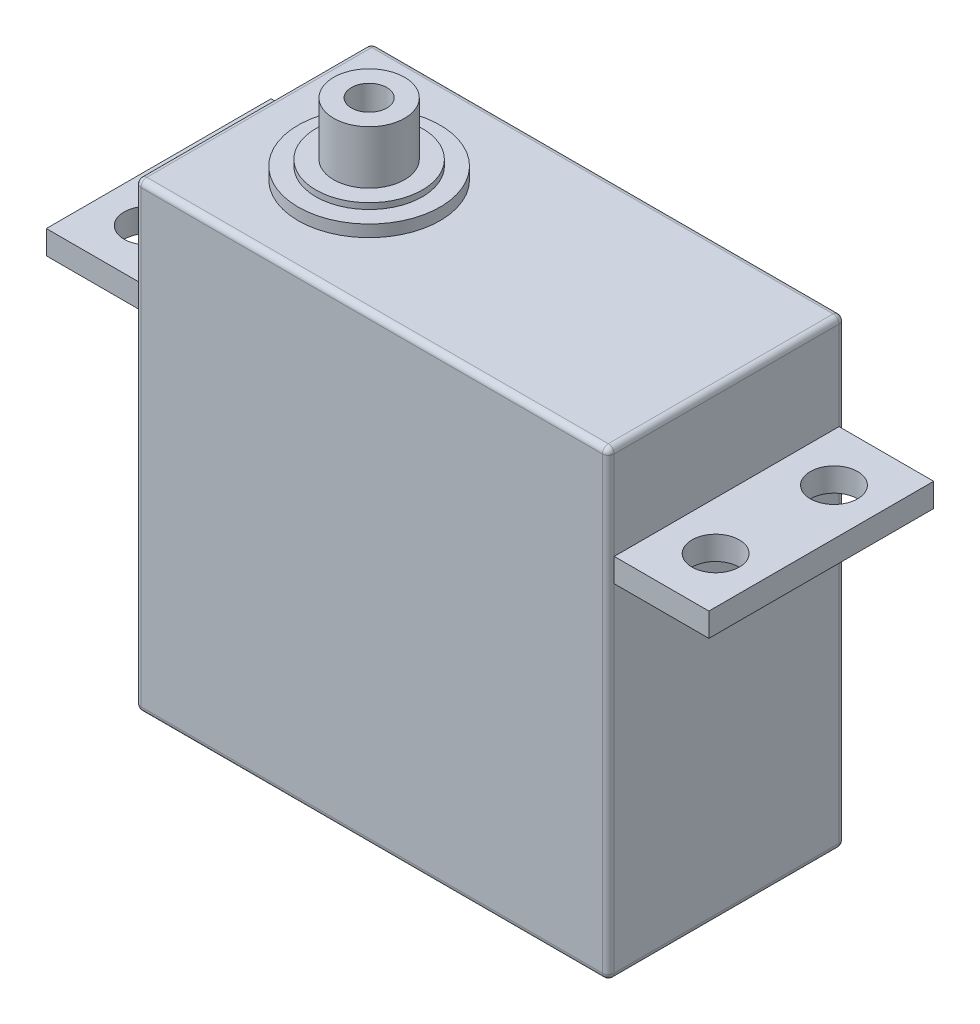
from build123d import *

# Parameters (mm, degrees)
SKETCH_1_W          = 40
SKETCH_1_H          = 39
EXTRUDE_2_DEPTH     = 20
FILLET_2_R          = 0.5
FILLET_3_R          = 0.5
FILLET_4_R          = 0.5
FILLET_5_R          = 0.5
SKETCH_6_W          = 19
SKETCH_6_H          = 2
EXTRUDE_3_DEPTH     = 8
SKETCH_7_W          = 19
SKETCH_7_H          = 2
EXTRUDE_5_DEPTH     = 8
SKETCH_8_R          = 2
CUT_EXTRUDE_1_DEPTH = 28
SKETCH_9_R          = 6
SKETCH_9_R_2        = 4.5
EXTRUDE_7_DEPTH     = 1
SKETCH_10_R         = 4.5
EXTRUDE_8_DEPTH     = 1.5
SKETCH_11_R         = 3
EXTRUDE_9_DEPTH     = 4.5
SKETCH_12_R         = 1.5
CUT_EXTRUDE_2_DEPTH = 6


with BuildPart() as part:
    # 草图1 → 凸台-拉伸2 (new body)
    with BuildSketch(Plane.XY):
        with Locations((20, 19.5)):
            Rectangle(SKETCH_1_W, SKETCH_1_H)
    extrude(amount=EXTRUDE_2_DEPTH)

    # 圆角2
    fillet_2_edges = [part.edges().sort_by_distance(p)[0] for p in [
        (40, 19.5, 20),
        (20, 39, 20),
    ]]
    fillet(fillet_2_edges, radius=FILLET_2_R)

    # 圆角3
    fillet_3_edges = [part.edges().sort_by_distance(p)[0] for p in [
        (40, 0, 9.75),
        (19.75, 0, 20),
        (39.853553391, 0, 19.853553391),
        (0, 39, 9.75),
        (0, 38.853553391, 19.853553391),
        (0, 19.25, 20),
    ]]
    fillet(fillet_3_edges, radius=FILLET_3_R)

    # 圆角4
    # the kernel refuses this fillet: 0.5 mm, written as the material it takes off along each edge
    with BuildSketch(Plane(origin=(39.5, 38.5, 19.5), x_dir=(0, 1, 0), z_dir=(1, 0, 0))) as fillet_4_piece_1_section:
        Polygon((0, 0), (FILLET_4_R, 0), (FILLET_4_R, FILLET_4_R), (0, FILLET_4_R), align=None)
    fillet_4_piece_1 = extrude(amount=FILLET_4_R, mode=Mode.PRIVATE)
    fillet_4_piece_1 = fillet_4_piece_1 - Plane(origin=(39.5, 38.5, 19.5), x_dir=(0, -0.7071067811865475, -0.7071067811865475), z_dir=(1, 0, 0)) * Sphere(FILLET_4_R, mode=Mode.PRIVATE)
    add(fillet_4_piece_1, mode=Mode.SUBTRACT)
    with BuildSketch(Plane(origin=(40, 39, -1.25), x_dir=(0, -1, 0), z_dir=(0, 0, 1))) as fillet_4_piece_2:
        with BuildLine():
            CenterArc((FILLET_4_R, -FILLET_4_R), FILLET_4_R, 90, 90)
            Line((0, -FILLET_4_R), (0, 0))
            Line((0, 0), (FILLET_4_R, 0))
        make_face()
    extrude(amount=20.75, mode=Mode.SUBTRACT)
    with BuildSketch(Plane(origin=(40, 0.5, 0), x_dir=(-1, 0, 0), z_dir=(0, 1, 0))) as fillet_4_piece_3:
        with BuildLine():
            CenterArc((FILLET_4_R, FILLET_4_R), FILLET_4_R, 180, 90)
            Line((0, FILLET_4_R), (0, 0))
            Line((0, 0), (FILLET_4_R, 0))
        make_face()
    extrude(amount=39.75, mode=Mode.SUBTRACT)
    with BuildSketch(Plane(origin=(39.5, 0.5, 0), x_dir=(0, -1, 0), z_dir=(-1, 0, 0))) as fillet_4_piece_4:
        with BuildLine():
            CenterArc((0.5 - FILLET_4_R, FILLET_4_R), FILLET_4_R, 270, 90)
            Line((0.5, FILLET_4_R), (0.5, 0))
            Line((0.5, 0), (0.5 - FILLET_4_R, 0))
        make_face()
    revolve(axis=Axis((39.5, 0.5, 0), (0, 0, 1)), revolution_arc=90, mode=Mode.SUBTRACT)
    with BuildSketch(Plane(origin=(-1.25, 0, 0), x_dir=(0, 0, 1), z_dir=(1, 0, 0))) as fillet_4_piece_5:
        with BuildLine():
            CenterArc((FILLET_4_R, -FILLET_4_R), FILLET_4_R, 90, 90)
            Line((0, -FILLET_4_R), (0, 0))
            Line((0, 0), (FILLET_4_R, 0))
        make_face()
    extrude(amount=40.75, mode=Mode.SUBTRACT)

    # 圆角5
    # the kernel refuses this fillet: 0.5 mm, written as the material it takes off along each edge
    with BuildSketch(Plane(origin=(0.5, 0.5, 19.5), x_dir=(-1, 0, 0), z_dir=(0, -1, 0))) as fillet_5_piece_1_section:
        Polygon((0, 0), (FILLET_5_R, 0), (FILLET_5_R, -FILLET_5_R), (0, -FILLET_5_R), align=None)
    fillet_5_piece_1 = extrude(amount=FILLET_5_R, mode=Mode.PRIVATE)
    fillet_5_piece_1 = fillet_5_piece_1 - Plane(origin=(0.5, 0.5, 19.5), x_dir=(0.7071067811865475, 0, -0.7071067811865475), z_dir=(0, -1, 0)) * Sphere(FILLET_5_R, mode=Mode.PRIVATE)
    add(fillet_5_piece_1, mode=Mode.SUBTRACT)
    with BuildSketch(Plane(origin=(39.5, 38.5, 0.5), x_dir=(0, 1, 0), z_dir=(0, 0, -1))) as fillet_5_piece_2_section:
        Polygon((0, 0), (FILLET_5_R, 0), (FILLET_5_R, FILLET_5_R), (0, FILLET_5_R), align=None)
    fillet_5_piece_2 = extrude(amount=FILLET_5_R, mode=Mode.PRIVATE)
    fillet_5_piece_2 = fillet_5_piece_2 - Plane(origin=(39.5, 38.5, 0.5), x_dir=(-0.7071067811865475, -0.7071067811865477, 0), z_dir=(0, 0, -1)) * Sphere(FILLET_5_R, mode=Mode.PRIVATE)
    add(fillet_5_piece_2, mode=Mode.SUBTRACT)
    with BuildSketch(Plane(origin=(39.5, 39, 0), x_dir=(0, -1, 0), z_dir=(-1, 0, 0))) as fillet_5_piece_3:
        with BuildLine():
            CenterArc((FILLET_5_R, FILLET_5_R), FILLET_5_R, 180, 90)
            Line((0, FILLET_5_R), (0, 0))
            Line((0, 0), (FILLET_5_R, 0))
        make_face()
    extrude(amount=39, mode=Mode.SUBTRACT)
    with BuildSketch(Plane(origin=(0.5, 38.5, 0), x_dir=(-1, 0, 0), z_dir=(0, -1, 0))) as fillet_5_piece_4:
        with BuildLine():
            CenterArc((0.5 - FILLET_5_R, -FILLET_5_R), FILLET_5_R, 0, 90)
            Line((0.5, -FILLET_5_R), (0.5, 0))
            Line((0.5, 0), (0.5 - FILLET_5_R, 0))
        make_face()
    revolve(axis=Axis((0.5, 38.5, 0), (0, 0, -1)), revolution_arc=90, mode=Mode.SUBTRACT)
    with BuildSketch(Plane(origin=(0, 0, 0.5), x_dir=(1, 0, 0), z_dir=(0, 0, 1))) as fillet_5_piece_5:
        with BuildLine():
            CenterArc((FILLET_5_R, FILLET_5_R), FILLET_5_R, 180, 90)
            Line((0, FILLET_5_R), (0, 0))
            Line((0, 0), (FILLET_5_R, 0))
        make_face()
    extrude(amount=19, mode=Mode.SUBTRACT)
    with BuildSketch(Plane(origin=(0, 38.5, 0), x_dir=(0, 0, 1), z_dir=(0, -1, 0))) as fillet_5_piece_6:
        with BuildLine():
            CenterArc((FILLET_5_R, -FILLET_5_R), FILLET_5_R, 90, 90)
            Line((0, -FILLET_5_R), (0, 0))
            Line((0, 0), (FILLET_5_R, 0))
        make_face()
    extrude(amount=38, mode=Mode.SUBTRACT)
    with BuildSketch(Plane(origin=(0, 0.5, 0.5), x_dir=(0, 0, -1), z_dir=(0, 1, 0))) as fillet_5_piece_7:
        with BuildLine():
            CenterArc((0.5 - FILLET_5_R, -FILLET_5_R), FILLET_5_R, 0, 90)
            Line((0.5 - FILLET_5_R, 0), (0.5, 0))
            Line((0.5, 0), (0.5, -FILLET_5_R))
        make_face()
    revolve(axis=Axis((0, 0.5, 0.5), (-1, 0, 0)), revolution_arc=90, mode=Mode.SUBTRACT)

    # 草图6 → 凸台-拉伸3 (add)
    with BuildSketch(Plane.ZY):
        with Locations((10, 30)):
            Rectangle(SKETCH_6_W, SKETCH_6_H)
    extrude(amount=EXTRUDE_3_DEPTH)

    # 草图7 → 凸台-拉伸5 (add)
    with BuildSketch(Plane(origin=(40, 0, 0), x_dir=(0, 0, -1), z_dir=(1, 0, 0))):
        with Locations((-10, 30)):
            Rectangle(SKETCH_7_W, SKETCH_7_H)
    extrude(amount=EXTRUDE_5_DEPTH)

    # 草图8 → 切除-拉伸1 (cut)
    with BuildSketch(Plane(origin=(0, 39, 0), x_dir=(1, 0, 0), z_dir=(0, 1, 0))):
        with Locations(Location((-3.928154272, -5, 0), (0, 0, 180))):
            Circle(SKETCH_8_R)
        with Locations(Location((-3.928154272, -15, 0), (0, 0, 180))):
            Circle(SKETCH_8_R)
        with Locations(Location((44.071845728, -5, 0), (0, 0, 180))):
            Circle(SKETCH_8_R)
        with Locations(Location((44.071845728, -15, 0), (0, 0, 180))):
            Circle(SKETCH_8_R)
    extrude(amount=-CUT_EXTRUDE_1_DEPTH, mode=Mode.SUBTRACT)

    # 草图9 → 凸台-拉伸7 (add)
    with BuildSketch(Plane(origin=(0, 39, 0), x_dir=(1, 0, 0), z_dir=(0, 1, 0))):
        with Locations(Location((10.071845728, -10.288024079, 0), (0, 0, 270))):
            Circle(SKETCH_9_R)
        with Locations(Location((10.071845728, -10.288024079, 0), (0, 0, 270))):
            Circle(SKETCH_9_R_2, mode=Mode.SUBTRACT)
    extrude(amount=EXTRUDE_7_DEPTH)

    # 草图10 → 凸台-拉伸8 (add)
    with BuildSketch(Plane(origin=(0, 39, 0), x_dir=(1, 0, 0), z_dir=(0, 1, 0))):
        with Locations(Location((10.071845728, -10.288024079, 0), (0, 0, 270))):
            Circle(SKETCH_10_R)
    extrude(amount=EXTRUDE_8_DEPTH)

    # 草图11 → 凸台-拉伸9 (add)
    with BuildSketch(Plane(origin=(0, 40.5, 0), x_dir=(1, 0, 0), z_dir=(0, 1, 0))):
        with Locations(Location((10.071845728, -10.288024079, 0), (0, 0, 270))):
            Circle(SKETCH_11_R)
    extrude(amount=EXTRUDE_9_DEPTH)

    # 草图12 → 切除-拉伸2 (cut)
    with BuildSketch(Plane(origin=(0, 45, 0), x_dir=(1, 0, 0), z_dir=(0, 1, 0))):
        with Locations(Location((10.071845728, -10.288024079, 0), (0, 0, 270))):
            Circle(SKETCH_12_R)
    extrude(amount=-CUT_EXTRUDE_2_DEPTH, mode=Mode.SUBTRACT)


solid = part.part
